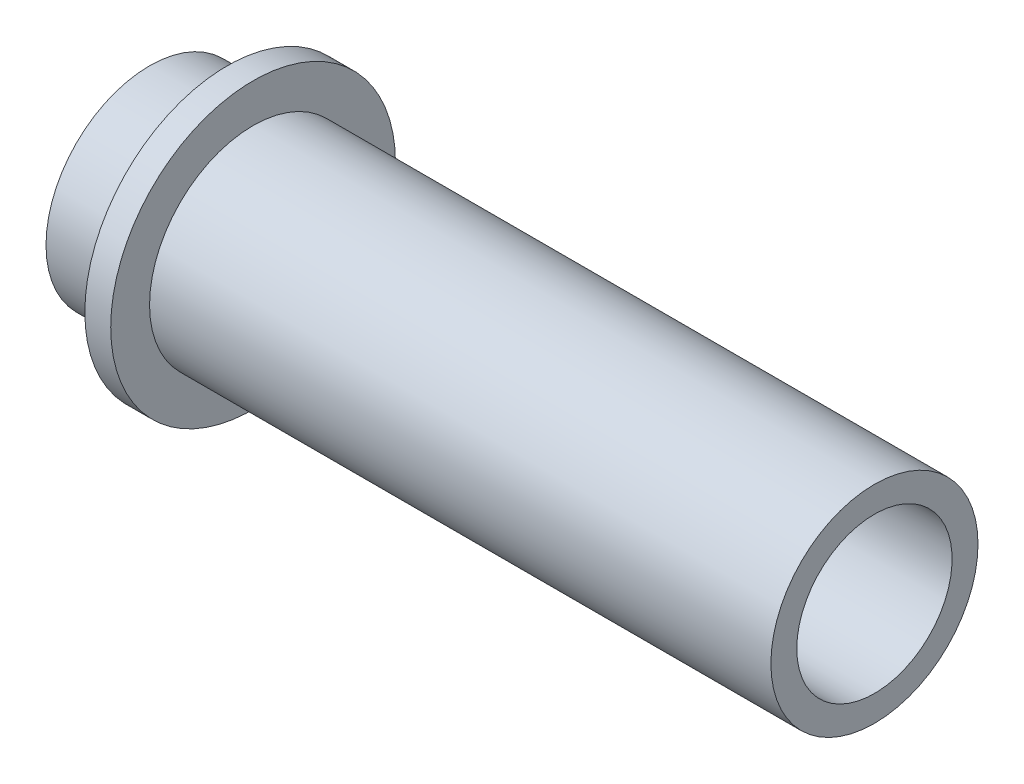
from build123d import *

# Parameters (mm, degrees)
SKETCH1_R           = 8.73125
BOSS_EXTRUDE1_DEPTH = 1.5875
SKETCH2_R           = 6.35
BOSS_EXTRUDE2_DEPTH = 38.1
BOSS_EXTRUDE3_START = 4.7625
SKETCH4_R           = 6.35
BOSS_EXTRUDE3_DEPTH = 4.7625
SKETCH5_R           = 4.7625
CUT_EXTRUDE1_DEPTH  = 47.13319795


with BuildPart() as part:
    # Sketch1 → Boss-Extrude1 (new body)
    with BuildSketch(Plane(origin=(0, 0, 0), x_dir=(0, 0, -1), z_dir=(1, 0, 0))):
        Circle(SKETCH1_R)
    extrude(amount=BOSS_EXTRUDE1_DEPTH)

    # Sketch2 → Boss-Extrude2 (add)
    with BuildSketch(Plane(origin=(1.5875, 0, 0), x_dir=(0, 0, -1), z_dir=(1, 0, 0))):
        Circle(SKETCH2_R)
    extrude(amount=BOSS_EXTRUDE2_DEPTH)

    # Sketch4 → Boss-Extrude3 (add)
    with BuildSketch(Plane.ZY.offset(BOSS_EXTRUDE3_START)):
        Circle(SKETCH4_R)
    extrude(amount=-BOSS_EXTRUDE3_DEPTH)

    # Sketch5 → Cut-Extrude1 (cut, through all)
    with BuildSketch(Plane.ZY.offset(4.7625)):
        Circle(SKETCH5_R)
    extrude(amount=-CUT_EXTRUDE1_DEPTH, mode=Mode.SUBTRACT)


solid = part.part
